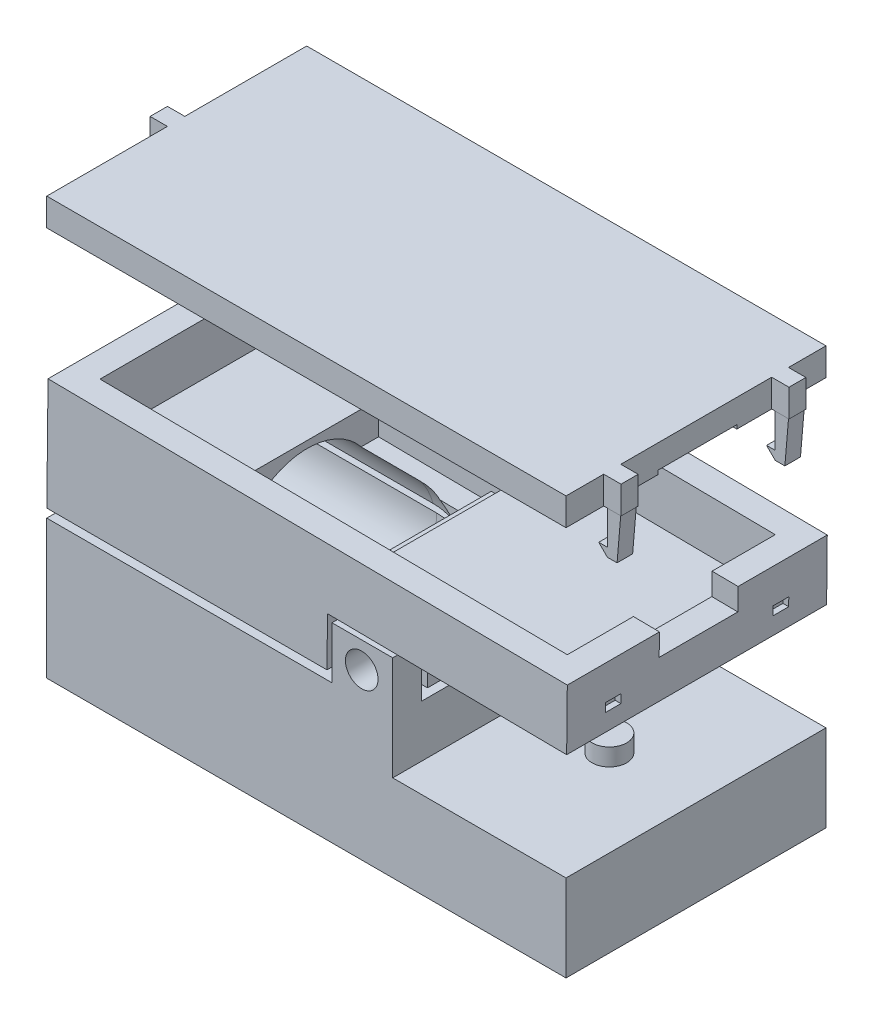
from build123d import *

# Parameters (mm, degrees)
SKETCH1_W              = 50.709309975
SKETCH1_H              = 38.1
BOSS_EXTRUDE1_DEPTH    = 20.32
SKETCH28_W             = 25.4
SKETCH28_H             = 38.1
BOSS_EXTRUDE2_DEPTH    = 12.7
SKETCH38_W             = 8.900689372
SKETCH38_H             = 4.191
BOSS_EXTRUDE12_DEPTH   = 10.16
BOSS_EXTRUDE12_2_DEPTH = 10.16
SKETCH40_W             = 76.109309975
SKETCH40_H             = 38.1
CUT_EXTRUDE8_DEPTH     = 3.81
SKETCH50_W             = 68.489309975
SKETCH50_H             = 30.48
CUT_EXTRUDE14_DEPTH    = 7.644589788
SKETCH57_W             = 76.109309975
SKETCH57_H             = 38.1
SKETCH57_W_2           = 68.489309975
SKETCH57_H_2           = 30.48
BOSS_EXTRUDE13_DEPTH   = 1.5
SKETCH59_W             = 76.109309975
SKETCH59_H             = 38.1
BOSS_EXTRUDE14_DEPTH   = 2.54
SKETCH98_W             = 2.47490523
SKETCH98_H             = 4.04
BOSS_EXTRUDE21_DEPTH   = 2.54
SKETCH98_W_2           = 2.504215853
BOSS_EXTRUDE21_2_DEPTH = 2.54
SNAP_START             = 11.133198286
SNAP_HOOK2_DEPTH       = 2.286
SNAP_START_2           = 50.8
SNAP_GROOVE1_OUTLINE_W = 0.83947741
SNAP_GROOVE1_OUTLINE_H = 2.286
SNAP_GROOVE1_DEPTH     = 1.27
SNAP_START_3           = -13.464252556
SNAP_HOOK3_DEPTH       = 2.286
SNAP_GROOVE2_OUTLINE_W = 0.840160892
SNAP_GROOVE2_OUTLINE_H = 2.286
SNAP_GROOVE2_DEPTH     = 1.27
SKETCH101_W            = 2.547252959
SKETCH101_H            = 4.04
BOSS_EXTRUDE22_DEPTH   = 2.54
SNAP_START_4           = -0.928538052
SNAP_HOOK4_DEPTH       = 2.032
SNAP_GROOVE3_OUTLINE_W = 0.875581881
SNAP_GROOVE3_OUTLINE_H = 2.032
SNAP_GROOVE3_DEPTH     = 1.27
SKETCH60_W             = 11.526412546
SKETCH60_H             = 3.816088359
CUT_EXTRUDE39_DEPTH    = 3.81
SKETCH64_R             = 2.54
BOSS_EXTRUDE17_DEPTH   = 2.54
SKETCH89_R             = 2.54
BOSS_EXTRUDE19_DEPTH   = 2.54
SKETCH72_W             = 5.08
SKETCH72_H             = 7.62
CUT_EXTRUDE28_DEPTH    = 9.652
SKETCH73_W             = 21.264313154
SKETCH73_H             = 7.62
CUT_EXTRUDE29_DEPTH    = 9.144
CUT_EXTRUDE32_DEPTH    = 38.1
SKETCH83_W             = 8.900689372
SKETCH83_H             = 4.191
CUT_EXTRUDE34_DEPTH    = 2.54
CUT_REVOLVE1_ANGLE     = 180
CUT_REVOLVE2_ANGLE     = 180
SKETCH88_W             = 16.51
SKETCH88_H             = 20.828
CUT_EXTRUDE41_DEPTH    = 4.826
SKETCH93_W             = 3.779934347
SKETCH93_H             = 20.828
CUT_EXTRUDE45_DEPTH    = 3.302
SKETCH91_W             = 16.51
SKETCH91_H             = 14.856341039
CUT_EXTRUDE42_DEPTH    = 5.08
BODY_MOVE_COPY2_ANGLE  = 0.6213346
CUT_EXTRUDE35_START    = -38.1
SKETCH84_R             = 2.39
CUT_EXTRUDE35_DEPTH    = 38.1


with BuildPart() as part:
    # Sketch1 → Boss-Extrude1 (new body)
    with BuildSketch(Plane(origin=(0, 0, 0), x_dir=(1, 0, 0), z_dir=(0, 1, 0))):
        with Locations((-12.745345012, 0)):
            Rectangle(SKETCH1_W, SKETCH1_H)
    extrude(amount=BOSS_EXTRUDE1_DEPTH)

    # Sketch28 → Boss-Extrude2 (add)
    with BuildSketch(Plane(origin=(0, 0, 0), x_dir=(1, 0, 0), z_dir=(0, 1, 0))):
        with Locations((25.309309975, 0)):
            Rectangle(SKETCH28_W, SKETCH28_H)
    extrude(amount=BOSS_EXTRUDE2_DEPTH)


with BuildPart() as body_2:
    # Sketch38 → Boss-Extrude12 (new body)
    with BuildSketch(Plane(origin=(0, 20.32, 0), x_dir=(1, 0, 0), z_dir=(0, 1, 0))):
        with Locations((8.158965289, -16.9545)):
            Rectangle(SKETCH38_W, SKETCH38_H)
    extrude(amount=BOSS_EXTRUDE12_DEPTH)


with BuildPart() as body_3:
    # Sketch38 → Boss-Extrude12 2 (new body)
    with BuildSketch(Plane(origin=(0, 20.32, 0), x_dir=(1, 0, 0), z_dir=(0, 1, 0))):
        with Locations((8.158965289, 16.9545)):
            Rectangle(SKETCH38_W, SKETCH38_H)
    extrude(amount=BOSS_EXTRUDE12_2_DEPTH)


with BuildPart() as body_4:
    # Mirror20: mirrored copy
    add(part.part.mirror(Plane.ZX.offset(30.48)))

    # Sketch40 → Cut-Extrude8 (cut)
    with BuildSketch(Plane(origin=(0, 60.96, 0), x_dir=(1, 0, 0), z_dir=(0, 1, 0))):
        with Locations((-0.045345013, 0)):
            Rectangle(SKETCH40_W, SKETCH40_H)
    extrude(amount=-CUT_EXTRUDE8_DEPTH, mode=Mode.SUBTRACT)

    # Sketch50 → Cut-Extrude14 (cut)
    with BuildSketch(Plane(origin=(0, 57.15, 0), x_dir=(1, 0, 0), z_dir=(0, 1, 0))):
        with Locations((-0.045345012, 0)):
            Rectangle(SKETCH50_W, SKETCH50_H)
    extrude(amount=-CUT_EXTRUDE14_DEPTH, mode=Mode.SUBTRACT)

    # Snap Groove1: read off the stored shape, not the designer's step
    # Snap Groove1 outline → Snap Groove1 (cut)
    with BuildSketch(Plane(origin=(0, 0, 0), x_dir=(1, 0, 0), z_dir=(0, 1, 0)).offset(SNAP_START_2)):
        with Locations((37.58957127, -12.276198286)):
            Rectangle(SNAP_GROOVE1_OUTLINE_W, SNAP_GROOVE1_OUTLINE_H)
    extrude(amount=SNAP_GROOVE1_DEPTH, mode=Mode.SUBTRACT)

    # Snap Groove2: read off the stored shape, not the designer's step
    # Snap Groove2 outline → Snap Groove2 (cut)
    with BuildSketch(Plane(origin=(0, 0, 0), x_dir=(1, 0, 0), z_dir=(0, 1, 0)).offset(SNAP_START_2)):
        with Locations((37.589229529, 12.321252556)):
            Rectangle(SNAP_GROOVE2_OUTLINE_W, SNAP_GROOVE2_OUTLINE_H)
    extrude(amount=SNAP_GROOVE2_DEPTH, mode=Mode.SUBTRACT)

    # Snap Groove3: read off the stored shape, not the designer's step
    # Snap Groove3 outline → Snap Groove3 (cut)
    with BuildSketch(Plane(origin=(0, 0, 0), x_dir=(1, 0, 0), z_dir=(0, 1, 0)).offset(SNAP_START_2)):
        with Locations((-37.66220906, -0.087461948)):
            Rectangle(SNAP_GROOVE3_OUTLINE_W, SNAP_GROOVE3_OUTLINE_H)
    extrude(amount=SNAP_GROOVE3_DEPTH, mode=Mode.SUBTRACT)


with BuildPart() as body_5:
    # Sketch57 → Boss-Extrude13 (new body)
    with BuildSketch(Plane(origin=(0, 57.15, 0), x_dir=(1, 0, 0), z_dir=(0, 1, 0))):
        with Locations((-0.045345013, 0)):
            Rectangle(SKETCH57_W, SKETCH57_H)
        with Locations((-0.045345012, 0)):
            Rectangle(SKETCH57_W_2, SKETCH57_H_2, mode=Mode.SUBTRACT)
    extrude(amount=BOSS_EXTRUDE13_DEPTH)

    # Sketch59 → Boss-Extrude14 (add)
    with BuildSketch(Plane(origin=(0, 58.65, 0), x_dir=(1, 0, 0), z_dir=(0, 1, 0))):
        with Locations((-0.045345013, 0)):
            Rectangle(SKETCH59_W, SKETCH59_H)
    extrude(amount=BOSS_EXTRUDE14_DEPTH)


with BuildPart() as body_6:
    # Sketch98 → Boss-Extrude21 (new body)
    with BuildSketch(Plane(origin=(38.009309975, 0, 0), x_dir=(0, 0, -1), z_dir=(1, 0, 0))):
        with Locations((12.321252556, 59.17)):
            Rectangle(SKETCH98_W, SKETCH98_H)
    extrude(amount=BOSS_EXTRUDE21_DEPTH)

    # Snap Hook3: read off the stored shape, not the designer's step
    # Snap Hook3 outline → Snap Hook3 (add)
    with BuildSketch(Plane.XY.offset(SNAP_START_3)):
        Polygon((40.394949083, 57.15), (38.439149083, 57.15), (38.439149083, 52.07), (37.169149083, 52.07), (38.439149083, 50.8), (39.855199083, 50.8), align=None)
    extrude(amount=SNAP_HOOK3_DEPTH)


with BuildPart() as body_7:
    # Sketch98 → Boss-Extrude21 2 (new body)
    with BuildSketch(Plane(origin=(38.009309975, 0, 0), x_dir=(0, 0, -1), z_dir=(1, 0, 0))):
        with Locations((-12.276198287, 59.17)):
            Rectangle(SKETCH98_W_2, SKETCH98_H)
    extrude(amount=BOSS_EXTRUDE21_2_DEPTH)

    # Snap Hook2: read off the stored shape, not the designer's step
    # Snap Hook2 outline → Snap Hook2 (add)
    with BuildSketch(Plane.XY.offset(SNAP_START)):
        Polygon((40.395632565, 57.15), (38.439832565, 57.15), (38.439832565, 52.07), (37.169832565, 52.07), (38.439832565, 50.8), (39.855882565, 50.8), align=None)
    extrude(amount=SNAP_HOOK2_DEPTH)


with BuildPart() as body_8:
    # Sketch101 → Boss-Extrude22 (new body)
    with BuildSketch(Plane.ZY.offset(38.1)):
        with Locations((0.087461949, 59.17)):
            Rectangle(SKETCH101_W, SKETCH101_H)
    extrude(amount=BOSS_EXTRUDE22_DEPTH)

    # Snap Hook4: read off the stored shape, not the designer's step
    # Snap Hook4 outline → Snap Hook4 (add)
    with BuildSketch(Plane.XY.offset(SNAP_START_4)):
        Polygon((-37.224418119, 52.07), (-38.494418119, 52.07), (-38.494418119, 57.15), (-40.450218119, 57.15), (-39.910468119, 50.8), (-38.494418119, 50.8), align=None)
    extrude(amount=SNAP_HOOK4_DEPTH)


with BuildPart() as cut_extrude39_tool:
    # Sketch60 → Cut-Extrude39 (new body)
    with BuildSketch(Plane(origin=(38.009309975, 0, 0), x_dir=(0, 0, -1), z_dir=(1, 0, 0))):
        with Locations((0.214328427, 55.808683715)):
            Rectangle(SKETCH60_W, SKETCH60_H)
    extrude(amount=-CUT_EXTRUDE39_DEPTH)


with BuildPart() as body_4_1:
    add(body_4.part)

    # Cut-Extrude39: cut by cut_extrude39_tool
    add(cut_extrude39_tool.part, mode=Mode.SUBTRACT)

    # Sketch89 → Boss-Extrude19 (add)
    with BuildSketch(Plane.XZ.offset(-48.26)):
        with Locations(Location((25.355478398, 0, 0), (0, 0, 90))):
            Circle(SKETCH89_R)
    extrude(amount=BOSS_EXTRUDE19_DEPTH)

    # Sketch72 → Cut-Extrude28 (cut)
    with BuildSketch(Plane(origin=(12.609309975, 0, 0), x_dir=(0, 0, -1), z_dir=(1, 0, 0))):
        with Locations((-16.51, 44.45)):
            Rectangle(SKETCH72_W, SKETCH72_H)
        with Locations((16.51, 44.45)):
            Rectangle(SKETCH72_W, SKETCH72_H)
    extrude(amount=-CUT_EXTRUDE28_DEPTH, mode=Mode.SUBTRACT)

    # Sketch73 → Cut-Extrude29 (cut)
    with BuildSketch(Plane(origin=(12.609309975, 0, 0), x_dir=(0, 0, -1), z_dir=(1, 0, 0))):
        with Locations((-0.028658104, 44.45)):
            Rectangle(SKETCH73_W, SKETCH73_H)
    extrude(amount=-CUT_EXTRUDE29_DEPTH, mode=Mode.SUBTRACT)

    # Sketch77 → Cut-Extrude32 (cut)
    with BuildSketch(Plane.XY.offset(19.05)):
        Polygon((-38.1, 40.64), (13.03451075, 40.64), (13.03451075, 41.194541436), align=None)
    extrude(amount=-CUT_EXTRUDE32_DEPTH, mode=Mode.SUBTRACT)

    # Sketch90 → Cut-Revolve2 (revolve, cut)
    with BuildSketch(Plane(origin=(-0.417615471, 38.508507013, 0), x_dir=(-0.9999412007895937, -0.010844121147678909, 0), z_dir=(0.010844121147678907, -0.9999412007895936, 0))):
        with BuildLine():
            Line((37.877407208, 0), (37.877407208, 0.53910201))
            Line((37.877407208, 0.53910201), (37.877407208, 10.170370063))
            Line((37.877407208, 10.170370063), (9.949419512, 10.170370063))
            add(Edge.make_bspline(
                [(9.949419512, 10.170370063), (-0.220352542, 10.170370063), (-0.220352542, 0)],
                knots=[0, 0, 0, 1.570796327, 1.570796327, 1.570796327], degree=2, weights=[1, 0.707106781, 1]))
            Line((-0.220352542, 0), (37.877407208, 0))
        make_face()
    revolve(axis=Axis((-38.292795517, 38.09775982, 0), (0.9999412007895937, 0.010844121147678886, 0)), revolution_arc=CUT_REVOLVE2_ANGLE, mode=Mode.SUBTRACT)

    # Sketch88 → Cut-Extrude41 (cut)
    with BuildSketch(Plane(origin=(0, 49.505410212, 0), x_dir=(1, 0, 0), z_dir=(0, 1, 0))):
        with Locations((-10.795, 0.063471515)):
            Rectangle(SKETCH88_W, SKETCH88_H)
    extrude(amount=-CUT_EXTRUDE41_DEPTH, mode=Mode.SUBTRACT)

    # Sketch93 → Cut-Extrude45 (cut)
    with BuildSketch(Plane(origin=(0, 49.505410212, 0), x_dir=(1, 0, 0), z_dir=(0, 1, 0))):
        with Locations((-0.650032826, 0.063471515)):
            Rectangle(SKETCH93_W, SKETCH93_H)
    extrude(amount=-CUT_EXTRUDE45_DEPTH, mode=Mode.SUBTRACT)

    # Sketch91 → Cut-Extrude42 (cut)
    with BuildSketch(Plane(origin=(0, 44.679410212, 0), x_dir=(1, 0, 0), z_dir=(0, 1, 0))):
        with Locations((-10.795, -0.321331661)):
            Rectangle(SKETCH91_W, SKETCH91_H)
    extrude(amount=-CUT_EXTRUDE42_DEPTH, mode=Mode.SUBTRACT)


with BuildPart() as body_5_1:
    add(body_5.part)

    # Cut-Extrude39: cut by cut_extrude39_tool
    add(cut_extrude39_tool.part, mode=Mode.SUBTRACT)


with BuildPart() as body_2_1:
    add(body_2.part)

    # Combine2: union part, body 3
    add(part.part)
    add(body_3.part)

    # Sketch64 → Boss-Extrude17 (add)
    with BuildSketch(Plane(origin=(0, 12.7, 0), x_dir=(1, 0, 0), z_dir=(0, 1, 0))):
        with Locations(Location((25.309309975, 0, 0), (0, 0, 90))):
            Circle(SKETCH64_R)
    extrude(amount=BOSS_EXTRUDE17_DEPTH)

    # Sketch83 → Cut-Extrude34 (cut)
    with BuildSketch(Plane(origin=(0, 30.48, 0), x_dir=(1, 0, 0), z_dir=(0, 1, 0))):
        with Locations((8.158965289, -16.9545)):
            Rectangle(SKETCH83_W, SKETCH83_H)
        with Locations((8.158965289, 16.9545)):
            Rectangle(SKETCH83_W, SKETCH83_H)
    extrude(amount=-CUT_EXTRUDE34_DEPTH, mode=Mode.SUBTRACT)

    # Sketch3 → Cut-Revolve1 (revolve, cut)
    with BuildSketch(Plane(origin=(0, 20.32, 0), x_dir=(1, 0, 0), z_dir=(0, 1, 0))):
        with BuildLine():
            Line((0, 0), (-38.1, 0))
            Line((-38.1, 0), (-38.1, -10.170370063))
            Line((-38.1, -10.170370063), (-10.170370063, -10.170370063))
            ThreePointArc((-10.170370063, -10.170370063), (-2.978832424, -7.191537639), (0, 0))
        make_face()
    revolve(axis=Axis((-38.1, 20.32, 0), (1, 0, 0)), revolution_arc=CUT_REVOLVE1_ANGLE, mode=Mode.SUBTRACT)


with BuildPart() as body_4_2:
    # Body-Move/Copy2: read off the stored shape, not the designer's step
    # Body-Move/Copy2: moved
    add(body_4_1.part.moved(Location((-0.2211198, -19.4643138, 0))).rotate(Axis((0, 0, 0), (0, 0, -1)), BODY_MOVE_COPY2_ANGLE))


with BuildPart() as cut_extrude35_tool:
    # Sketch84 → Cut-Extrude35 (new body)
    with BuildSketch(Plane.XY.offset(19.05).offset(CUT_EXTRUDE35_START)):
        with Locations((8.065647024, 24.13)):
            Circle(SKETCH84_R)
    extrude(amount=CUT_EXTRUDE35_DEPTH)


with BuildPart() as body_2_2:
    add(body_2_1.part)

    # Cut-Extrude35: cut by cut_extrude35_tool
    add(cut_extrude35_tool.part, mode=Mode.SUBTRACT)


with BuildPart() as body_4_3:
    add(body_4_2.part)

    # Cut-Extrude35: cut by cut_extrude35_tool
    add(cut_extrude35_tool.part, mode=Mode.SUBTRACT)


with BuildPart() as body_8_1:
    add(body_8.part)

    # Combine3: union body 5
    add(body_5_1.part)


with BuildPart() as body_6_1:
    add(body_6.part)

    # Combine4: union body 8, body 7
    add(body_8_1.part)
    add(body_7.part)


solid = Compound([body_2_2.part, body_4_3.part, body_6_1.part])
